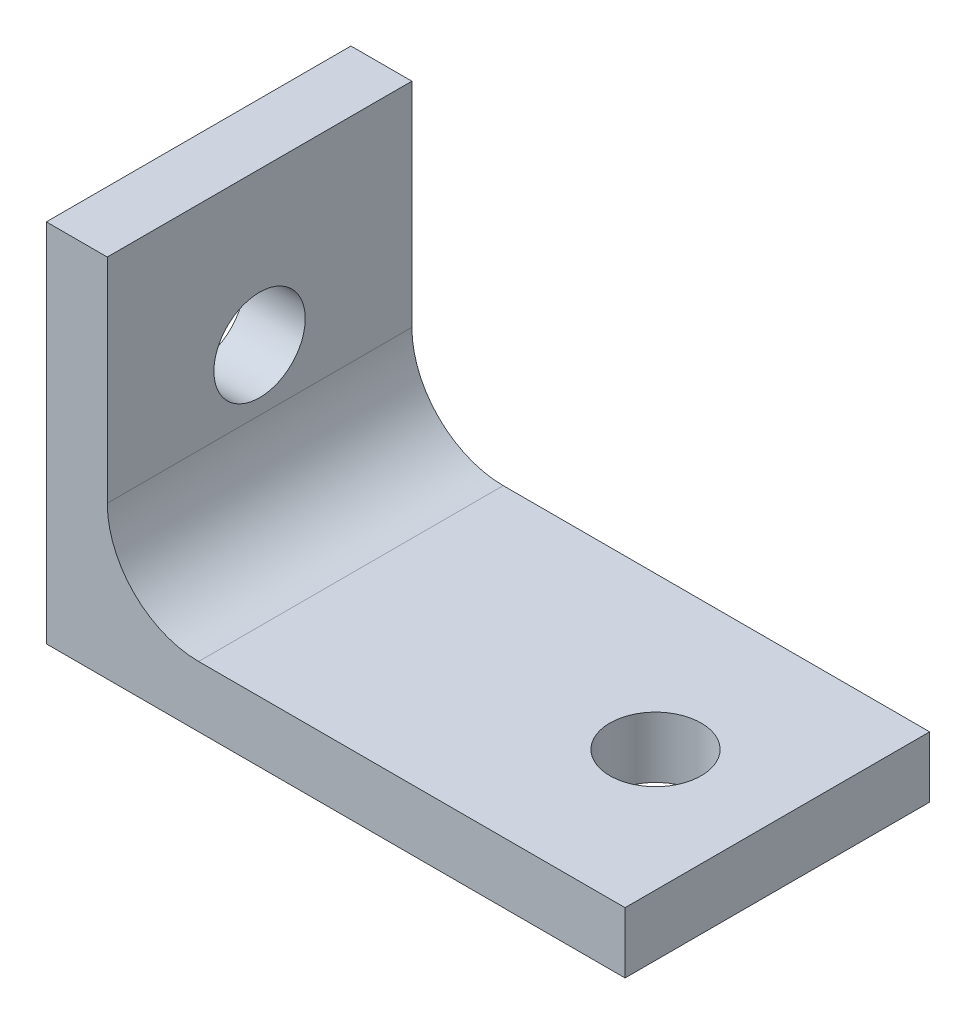
from build123d import *

# Parameters (mm, degrees)
BOSS_EXTRUDE1_DEPTH = 10
SKETCH2_R           = 1.5
CUT_EXTRUDE1_DEPTH  = 23.065804052
SKETCH3_R           = 1.5
CUT_EXTRUDE2_DEPTH  = 19.674960436
FILLET1_R           = 3


with BuildPart() as part:
    # Sketch1 → Boss-Extrude1 (new body)
    with BuildSketch(Plane.XY):
        Polygon((-6.803519062, 2.105571848), (-6.803519062, -9.894428152), (12.196480938, -9.894428152), (12.196480938, -7.894428152), (-4.803519062, -7.894428152), (-4.803519062, 2.105571848), align=None)
    extrude(amount=BOSS_EXTRUDE1_DEPTH)

    # Sketch2 → Cut-Extrude1 (cut, through all)
    with BuildSketch(Plane(origin=(-4.803519062, 0, 0), x_dir=(0, 0, -1), z_dir=(1, 0, 0))):
        with Locations((-5, -2.894428152)):
            Circle(SKETCH2_R)
    extrude(amount=-CUT_EXTRUDE1_DEPTH, mode=Mode.SUBTRACT)

    # Sketch3 → Cut-Extrude2 (cut, through all)
    with BuildSketch(Plane(origin=(0, -7.894428152, 0), x_dir=(1, 0, 0), z_dir=(0, 1, 0))):
        with Locations((8.196480938, -5)):
            Circle(SKETCH3_R)
    extrude(amount=-CUT_EXTRUDE2_DEPTH, mode=Mode.SUBTRACT)

    # Fillet1
    fillet1_edges = [part.edges().sort_by_distance(p)[0] for p in [
        (-4.803519062, -7.894428152, 5),
    ]]
    fillet(fillet1_edges, radius=FILLET1_R)


solid = part.part
